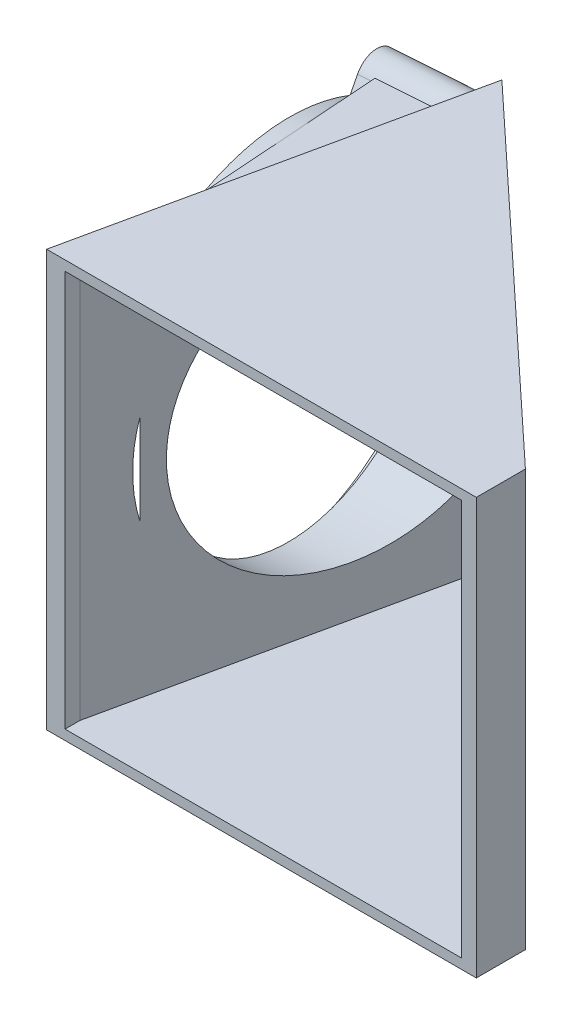
from build123d import *

# Parameters (mm, degrees)
EXTRUDE_1_DEPTH                 = 40
EXTRUDE_1_DEPTH_BACK            = 40
EXTRUDE_2_DEPTH                 = 2
CUT_EXTRUDE_1_REACH             = 119.95
SKETCH_5_W                      = 80
SKETCH_5_H                      = 80
EXTRUDE_3_DEPTH                 = 40
EXTRUDE_3_DEPTH_BACK            = 40
SKETCH_8_R                      = 35.5
CUT_EXTRUDE_2_DEPTH             = 1
CUT_EXTRUDE_2_DIRECTION_2_REACH = 118.572
EXTRUDE_START                   = 3
SKETCH_9_R                      = 40
SKETCH_9_R_2                    = 35.5
EXTRUDE_4_DEPTH                 = 3
CUT_EXTRUDE_3_REACH             = 127.349
SKETCH_10_W                     = 71.763601152
SKETCH_10_H                     = 80
CUT_EXTRUDE_4_REACH             = 128.159
SKETCH_11_R                     = 30
EXTRUDE_5_REACH                 = 128.159
SKETCH_12_R                     = 2.05
SKETCH_13_R                     = 2.05
CUT_EXTRUDE_5_DEPTH             = 5


with BuildPart() as part:
    # 草图3 → 凸台-拉伸1 (new, two sides: drawn at the far end of the back side and taken through both)
    with BuildSketch(Plane(origin=(0, 0, 0), x_dir=(1, 0, 0), z_dir=(0, 1, 0)).offset(-EXTRUDE_1_DEPTH_BACK)):
        Polygon((15.187390863, 70.138132347), (0, 0), (80, 0), (80, 9.699396554), (83, 6.901851296), (83, -3), (-3.719132052, -3), (12.633544334, 72.519632763), align=None)
    extrude(amount=EXTRUDE_1_DEPTH + EXTRUDE_1_DEPTH_BACK)

    # 草图4 → 凸台-拉伸2 (add)
    with BuildSketch(Plane.XZ.offset(40)):
        Polygon((12.633544334, -72.519632763), (83, -6.901851296), (83, 3), (-3.719132052, 3), align=None)
    extrude_2 = extrude(amount=EXTRUDE_2_DEPTH)

    # 镜向1: 凸台-拉伸2 across plane
    add(extrude_2.mirror(Plane.ZX))

    # 草图5 → 切除-拉伸1 (cut, up to next)
    with BuildSketch(Plane(origin=(0, 0, 0), x_dir=(-1, 0, 0), z_dir=(0, 0, -1)), mode=Mode.PRIVATE) as cut_extrude_1_sk1:
        with Locations((-40, 0)):
            Rectangle(SKETCH_5_W, SKETCH_5_H)
    cut_extrude_1_tool1 = extrude(cut_extrude_1_sk1.sketch, amount=-CUT_EXTRUDE_1_REACH, mode=Mode.PRIVATE) & part.part
    add(cut_extrude_1_tool1.solids().sort_by_distance((40, 0, 0))[0], mode=Mode.SUBTRACT)

    # 草图7 → 凸台-拉伸3 (add, two sides: drawn at the far end of the back side and taken through both)
    with BuildSketch(Plane(origin=(0, 0, 0), x_dir=(1, 0, 0), z_dir=(0, 1, 0)).offset(-EXTRUDE_3_DEPTH_BACK)):
        Polygon((0.658640833, 17.217351141), (11.911542727, 69.185298069), (-2.678558655, 64.941527254), align=None)
    extrude(amount=EXTRUDE_3_DEPTH + EXTRUDE_3_DEPTH_BACK)

    # 草图8 → 切除-拉伸2 (cut)
    with BuildSketch(Plane(origin=(1.853531984, 0, -0.129611582), x_dir=(0.06975647374411541, 0, 0.997564050259825), z_dir=(-0.9975640502598251, 0, 0.06975647374411541))):
        with Locations((-44.095251412, 0)):
            Circle(SKETCH_8_R)
    extrude(amount=-CUT_EXTRUDE_2_DEPTH, mode=Mode.SUBTRACT)

    # 草图8 → 切除-拉伸2 direction 2 (cut, up to next)
    with BuildSketch(Plane(origin=(1.853531984, 0, -0.129611582), x_dir=(0.06975647374411541, 0, 0.997564050259825), z_dir=(-0.9975640502598251, 0, 0.06975647374411541)), mode=Mode.PRIVATE) as cut_extrude_2_direction_2_sk1:
        with Locations((-44.095251412, 0)):
            Circle(SKETCH_8_R)
    cut_extrude_2_direction_2_tool1 = extrude(cut_extrude_2_direction_2_sk1.sketch, amount=CUT_EXTRUDE_2_DIRECTION_2_REACH, mode=Mode.PRIVATE) & part.part
    add(cut_extrude_2_direction_2_tool1.solids().sort_by_distance((-1.222397, 0, -44.117449))[0], mode=Mode.SUBTRACT)

    # 草图9 → 凸台-拉伸4 (add)
    with BuildSketch(Plane(origin=(1.853531984, 0, -0.129611582), x_dir=(0.06975647374411541, 0, 0.997564050259825), z_dir=(-0.9975640502598251, 0, 0.06975647374411541)).offset(EXTRUDE_START)):
        with Locations((-44.095251412, 0)):
            Circle(SKETCH_9_R)
        with Locations((-44.095251412, 0)):
            Circle(SKETCH_9_R_2, mode=Mode.SUBTRACT)
    extrude(amount=-EXTRUDE_4_DEPTH)

    # 草图10 → 切除-拉伸3 (cut, up to next)
    with BuildSketch(Plane(origin=(0, 0, 0), x_dir=(0.21163083539135819, 0, -0.9773496761709987), z_dir=(0.9773496761709987, 0, 0.21163083539135819)), mode=Mode.PRIVATE) as cut_extrude_3_sk1:
        with Locations((35.881800576, 0)):
            Rectangle(SKETCH_10_W, SKETCH_10_H)
    cut_extrude_3_tool1 = extrude(cut_extrude_3_sk1.sketch, amount=CUT_EXTRUDE_3_REACH, mode=Mode.PRIVATE) & part.part
    add(cut_extrude_3_tool1.solids().sort_by_distance((7.593695, 0, -35.069066))[0], mode=Mode.SUBTRACT)

    # 草图11 → 切除-拉伸4 (cut, up to next)
    with BuildSketch(Plane(origin=(-1.139160167, 0, 0.079657839), x_dir=(0.06975647374411542, 0, 0.997564050259825), z_dir=(-0.9975640502598251, 0, 0.06975647374411542)), mode=Mode.PRIVATE) as cut_extrude_4_sk1:
        with Locations((-44.095251412, 0)):
            Circle(SKETCH_11_R)
    cut_extrude_4_tool1 = extrude(cut_extrude_4_sk1.sketch, amount=-CUT_EXTRUDE_4_REACH, mode=Mode.PRIVATE) & part.part
    add(cut_extrude_4_tool1.solids().sort_by_distance((-4.215089, 0, -43.90818))[0], mode=Mode.SUBTRACT)

    # 草图12 → 凸台-拉伸5 (add, up to next)
    with BuildSketch(Plane(origin=(-1.139160167, 0, 0.079657839), x_dir=(0.06975647374411542, 0, 0.997564050259825), z_dir=(-0.9975640502598251, 0, 0.06975647374411542)), mode=Mode.PRIVATE) as extrude_5_sk1:
        with BuildLine():
            Line((-61.698137095, 39.489092363), (-60.198137095, 36.891016151))
            ThreePointArc((-60.198137095, 36.891016151), (-61.845251412, 30.743901834), (-67.992365729, 32.391016151))
            Line((-67.992365729, 32.391016151), (-69.492365729, 34.989092363))
            ThreePointArc((-69.492365729, 34.989092363), (-67.845251412, 41.13620668), (-61.698137095, 39.489092363))
        make_face()
        with Locations((-65.595251412, 37.239092363)):
            Circle(SKETCH_12_R, mode=Mode.SUBTRACT)
    extrude_5_tool1 = extrude(extrude_5_sk1.sketch, amount=-EXTRUDE_5_REACH, mode=Mode.PRIVATE) - part.part
    # 草图12 → 凸台-拉伸5 (add, up to next)
    with BuildSketch(Plane(origin=(-1.139160167, 0, 0.079657839), x_dir=(0.06975647374411542, 0, 0.997564050259825), z_dir=(-0.9975640502598251, 0, 0.06975647374411542)), mode=Mode.PRIVATE) as extrude_5_sk2:
        with BuildLine():
            Line((-14.075759582, 31.113985766), (-15.922744008, 28.749953505))
            ThreePointArc((-15.922744008, 28.749953505), (-22.239269038, 27.974381753), (-23.014840791, 34.290906783))
            Line((-23.014840791, 34.290906783), (-21.167856365, 36.654939044))
            ThreePointArc((-21.167856365, 36.654939044), (-14.851331334, 37.430510796), (-14.075759582, 31.113985766))
        make_face()
        with Locations((-17.621807973, 33.884462405)):
            Circle(SKETCH_12_R, mode=Mode.SUBTRACT)
    extrude_5_tool2 = extrude(extrude_5_sk2.sketch, amount=-EXTRUDE_5_REACH, mode=Mode.PRIVATE) - part.part
    # 草图12 → 凸台-拉伸5 (add, up to next)
    with BuildSketch(Plane(origin=(-1.139160167, 0, 0.079657839), x_dir=(0.06975647374411542, 0, 0.997564050259825), z_dir=(-0.9975640502598251, 0, 0.06975647374411542)), mode=Mode.PRIVATE) as extrude_5_sk3:
        with BuildLine():
            Line((-14.075759582, -31.113985766), (-15.922744008, -28.749953505))
            ThreePointArc((-15.922744008, -28.749953505), (-22.239269038, -27.974381753), (-23.014840791, -34.290906783))
            Line((-23.014840791, -34.290906783), (-21.167856365, -36.654939044))
            ThreePointArc((-21.167856365, -36.654939044), (-14.851331334, -37.430510796), (-14.075759582, -31.113985766))
        make_face()
        with Locations((-17.621807973, -33.884462405)):
            Circle(SKETCH_12_R, mode=Mode.SUBTRACT)
    extrude_5_tool3 = extrude(extrude_5_sk3.sketch, amount=-EXTRUDE_5_REACH, mode=Mode.PRIVATE) - part.part
    # 草图12 → 凸台-拉伸5 (add, up to next)
    with BuildSketch(Plane(origin=(-1.139160167, 0, 0.079657839), x_dir=(0.06975647374411542, 0, 0.997564050259825), z_dir=(-0.9975640502598251, 0, 0.06975647374411542)), mode=Mode.PRIVATE) as extrude_5_sk4:
        with BuildLine():
            Line((-61.698137095, -39.489092363), (-60.198137095, -36.891016151))
            ThreePointArc((-60.198137095, -36.891016151), (-61.845251412, -30.743901834), (-67.992365729, -32.391016151))
            Line((-67.992365729, -32.391016151), (-69.492365729, -34.989092363))
            ThreePointArc((-69.492365729, -34.989092363), (-67.845251412, -41.13620668), (-61.698137095, -39.489092363))
        make_face()
        with Locations((-65.595251412, -37.239092363)):
            Circle(SKETCH_12_R, mode=Mode.SUBTRACT)
    extrude_5_tool4 = extrude(extrude_5_sk4.sketch, amount=-EXTRUDE_5_REACH, mode=Mode.PRIVATE) - part.part
    add(extrude_5_tool1.solids().sort_by_distance((-5.400139, 38.111829, -60.855172))[0])
    add(extrude_5_tool2.solids().sort_by_distance((-2.194091, 30.028689, -15.00655))[0])
    add(extrude_5_tool3.solids().sort_by_distance((-2.194091, -30.028689, -15.00655))[0])
    add(extrude_5_tool4.solids().sort_by_distance((-5.400139, -38.111829, -60.855172))[0])

    # 草图13 → 切除-拉伸5 (cut)
    with BuildSketch(Plane(origin=(-1.139160167, 0, 0.079657839), x_dir=(0.06975647374411542, 0, 0.997564050259825), z_dir=(-0.9975640502598251, 0, 0.06975647374411542))):
        with Locations((-65.595251412, -37.239092363)):
            Circle(SKETCH_13_R)
        with Locations((-17.621807973, -33.884462405)):
            Circle(SKETCH_13_R)
        with Locations((-17.621807973, 33.884462405)):
            Circle(SKETCH_13_R)
        with Locations((-65.595251412, 37.239092363)):
            Circle(SKETCH_13_R)
    extrude(amount=-CUT_EXTRUDE_5_DEPTH, mode=Mode.SUBTRACT)


solid = part.part
